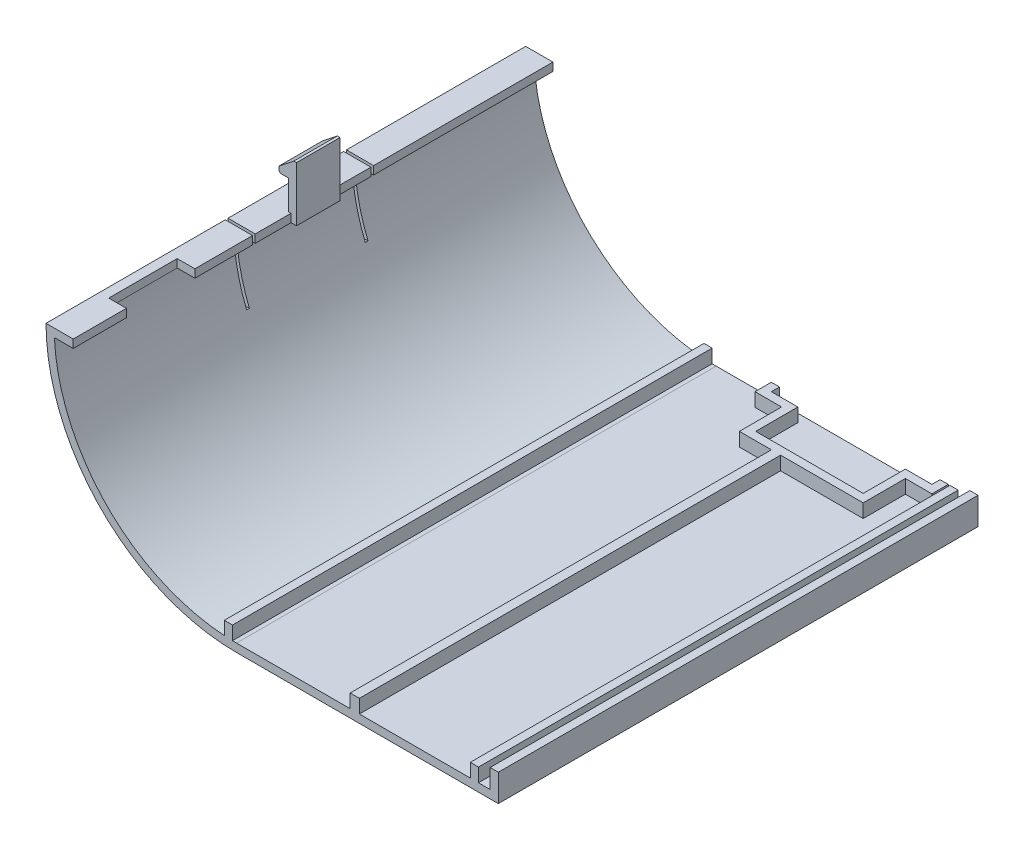
from build123d import *

# Parameters (mm, degrees)
EXTRUDE_START          = 0.1
EXTRUDE_1_DEPTH        = 70.5
SKETCH_3_W             = 0.4
SKETCH_3_H             = 10
CUT_EXTRUDE_1_DEPTH    = 89.958131389
EXTRUDE_START_2        = 0.3
EXTRUDE_2_DEPTH        = 6.4
EXTRUDE_3_REACH        = 103.657
EXTRUDE_3_START_RADIUS = 28
EXTRUDE_3_END_RADIUS   = 28
SKETCH_5_W             = 8.845499788
SKETCH_5_H             = 0.6
SKETCH_6_W             = 1.2
SKETCH_6_H             = 70.5
EXTRUDE_4_DEPTH        = 2
SKETCH_7_W             = 7.03
SKETCH_7_H             = 10.06
CUT_EXTRUDE_2_DEPTH    = 2


# Read off the part's stored shape, not the designer's step: Бобышка-Вытянуть2
with BuildPart() as part:
    # Эскиз1 → Бобышка-Вытянуть1 (new body)
    with BuildSketch(Plane.XY.offset(EXTRUDE_START)):
        with BuildLine():
            Line((20.652219826, -28.8), (-17.823198335, -28.8))
            ThreePointArc((-17.823198335, -28.8), (-37.586801245, -20.634313701), (-45.823019763, -0.9))
            Line((-45.823019763, -0.9), (-41.823019763, -0.9))
            Line((-41.823019763, -0.9), (-41.823019763, -2.1))
            Line((-41.823019763, -2.1), (-44.591649915, -2.1))
            ThreePointArc((-44.591649915, -2.1), (-36.308327493, -20.204638621), (-17.823198335, -27.6))
            Line((-17.823198335, -27.6), (19.452219826, -27.6))
            Line((19.452219826, -27.6), (19.452219826, -24.8))
            Line((19.452219826, -24.8), (20.652219826, -24.8))
            Line((20.652219826, -24.8), (20.652219826, -28.8))
        make_face()
    extrude(amount=EXTRUDE_1_DEPTH)

    # Эскиз3 → Вырез-Вытянуть1 (cut, through all)
    with BuildSketch(Plane(origin=(0, 0, 0), x_dir=(0, 0, -1), z_dir=(1, 0, 0))):
        with Locations((-44.05, -5.8)):
            Rectangle(SKETCH_3_W, SKETCH_3_H)
        with Locations((-26.65, -5.9)):
            Rectangle(SKETCH_3_W, SKETCH_3_H)
    extrude(amount=-CUT_EXTRUDE_1_DEPTH, mode=Mode.SUBTRACT)

    # Бобышка-Вытянуть2 outline → Бобышка-Вытянуть2 (add)
    with BuildSketch(Plane.XY.offset(31.886146776).offset(EXTRUDE_START_2)):
        with BuildLine():
            Line((-41.823019763, -2.1), (-41.023198335, -2.1))
            Line((-41.023198335, -2.1), (-41.023198335, 5.941310574))
            Line((-41.023198335, 5.941310574), (-41.423198335, 5.941310574))
            Line((-41.423198335, 5.941310574), (-43.62142157, 4.2))
            Line((-43.62142157, 4.2), (-43.62142157, 3.8))
            ThreePointArc((-43.62142157, 3.8), (-43.504264282, 3.517157288), (-43.22142157, 3.4))
            Line((-43.22142157, 3.4), (-42.223198335, 3.4))
            Line((-42.223198335, 3.4), (-42.223198335, -0.9))
            Line((-42.223198335, -0.9), (-41.823019763, -0.9))
            Line((-41.823019763, -0.9), (-41.823019763, -2.1))
        make_face()
    extrude(amount=EXTRUDE_2_DEPTH)

    # Бобышка-Вытянуть3: from a cylinder face, 103.657 long prism both ways, kept between that surface and its translate by the depth
    extrude_3_start = Plane(origin=(-17.823198335, -0.8, 35.35), z_dir=(0, 0, -1)) * Cylinder(EXTRUDE_3_START_RADIUS, 264.314, mode=Mode.PRIVATE)
    extrude_3_end = Plane(origin=(-18.323198335, -0.8, 35.35), z_dir=(0, 0, -1)) * Cylinder(EXTRUDE_3_END_RADIUS, 264.314, mode=Mode.PRIVATE)
    # Эскиз5 → Бобышка-Вытянуть3 (add, from a surface)
    with BuildSketch(Plane.ZY.offset(45.823198335), mode=Mode.PRIVATE) as extrude_3_sk1:
        with Locations((35.35, -3.019441342)):
            Rectangle(SKETCH_5_W, SKETCH_5_H)
    extrude_3_tool1 = extrude(extrude_3_sk1.sketch, amount=EXTRUDE_3_REACH, both=True, mode=Mode.PRIVATE)
    add(((extrude_3_tool1 - extrude_3_start) & extrude_3_end).solids().sort_by_distance((-45.34413, -3.019441, 35.35))[0])
    # Эскиз5 → Бобышка-Вытянуть3 (add, from a surface)
    with BuildSketch(Plane.ZY.offset(45.823198335), mode=Mode.PRIVATE) as extrude_3_sk2:
        with Locations((35.35, -4.419441342)):
            Rectangle(SKETCH_5_W, SKETCH_5_H)
    extrude_3_tool2 = extrude(extrude_3_sk2.sketch, amount=EXTRUDE_3_REACH, both=True, mode=Mode.PRIVATE)
    add(((extrude_3_tool2 - extrude_3_start) & extrude_3_end).solids().sort_by_distance((-45.34413, -3.019441, 35.35))[0])
    # Эскиз5 → Бобышка-Вытянуть3 (add, from a surface)
    with BuildSketch(Plane.ZY.offset(45.823198335), mode=Mode.PRIVATE) as extrude_3_sk3:
        with Locations((35.35, -5.819441342)):
            Rectangle(SKETCH_5_W, SKETCH_5_H)
    extrude_3_tool3 = extrude(extrude_3_sk3.sketch, amount=EXTRUDE_3_REACH, both=True, mode=Mode.PRIVATE)
    add(((extrude_3_tool3 - extrude_3_start) & extrude_3_end).solids().sort_by_distance((-45.34413, -3.019441, 35.35))[0])
    # Эскиз5 → Бобышка-Вытянуть3 (add, from a surface)
    with BuildSketch(Plane.ZY.offset(45.823198335), mode=Mode.PRIVATE) as extrude_3_sk4:
        Polygon((30.927250106, -7.519441342), (35.35, -9.519441342), (39.772749894, -7.519441342), (39.772749894, -6.919441342), (30.927250106, -6.919441342), align=None)
    extrude_3_tool4 = extrude(extrude_3_sk4.sketch, amount=EXTRUDE_3_REACH, both=True, mode=Mode.PRIVATE)
    add(((extrude_3_tool4 - extrude_3_start) & extrude_3_end).solids().sort_by_distance((-45.34413, -3.019441, 35.35))[0])

    # Эскиз6 → Бобышка-Вытянуть4 (add)
    with BuildSketch(Plane(origin=(0, -27.6, 0), x_dir=(1, 0, 0), z_dir=(0, 1, 0))):
        with Locations((-19.018158387, -35.35)):
            Rectangle(SKETCH_6_W, SKETCH_6_H)
        with Locations((17.134396076, -35.35)):
            Rectangle(SKETCH_6_W, SKETCH_6_H)
        Polygon((0.234396076, -8.7), (12.380116687, -8.7), (12.380116687, -2.5), (16.280116687, -2.5), (16.280116687, -0.1), (15.080116687, -0.1), (15.080116687, -1.3), (11.180116687, -1.3), (11.180116687, -7.5), (-4.619883313, -7.5), (-4.619883313, -1.3), (-8.519883313, -1.3), (-8.519883313, -0.1), (-9.719883313, -0.1), (-9.719883313, -2.5), (-5.819883313, -2.5), (-5.819883313, -8.7), (-1.118158387, -8.7), (-1.118158387, -70.6), (0.234396076, -70.6), align=None)
    extrude(amount=EXTRUDE_4_DEPTH)

    # Эскиз7 → Вырез-Вытянуть2 (cut)
    with BuildSketch(Plane(origin=(0, -0.9, 0), x_dir=(1, 0, 0), z_dir=(0, 1, 0))):
        with Locations((-40.908198335, -57.75)):
            Rectangle(SKETCH_7_W, SKETCH_7_H)
    extrude(amount=-CUT_EXTRUDE_2_DEPTH, mode=Mode.SUBTRACT)


solid = part.part
